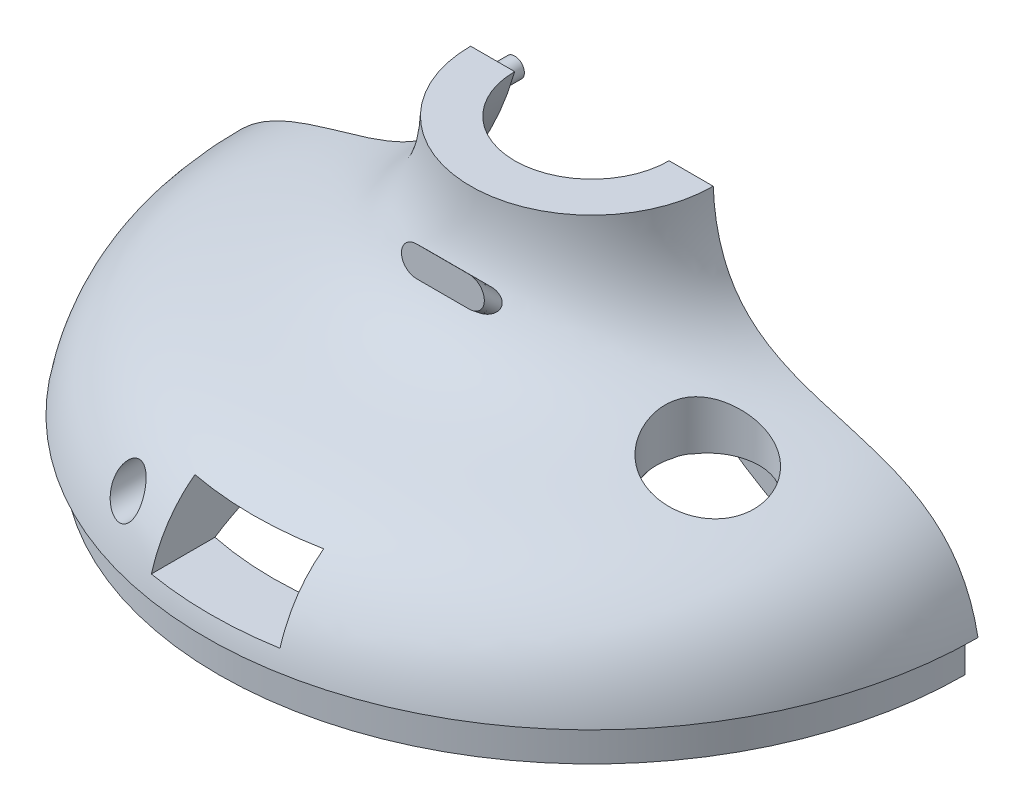
from build123d import *

# Parameters (mm, degrees)
R_VOLUTION1_ANGLE            = 90
ESQUISSE6_R                  = 3.75
BOSS_EXTRU_1_DEPTH           = 10
R_P_TITION_CIRCULAIRE2_COUNT = 2
R_P_TITION_CIRCULAIRE2_ANGLE = 270
R_P_TITION_CIRCULAIRE3_COUNT = 2
R_P_TITION_CIRCULAIRE3_ANGLE = 90
ESQUISSE10_R                 = 20
ENL_V_MAT_EXTRU_2_DEPTH      = 242.513478169
ESQUISSE11_R                 = 7.5
ESQUISSE11_W                 = 50
ESQUISSE11_H                 = 25
ENL_V_MAT_EXTRU_3_DEPTH      = 248.848260247
ESQUISSE12_W                 = 42.5
ESQUISSE12_H                 = 42.5
ENL_V_MAT_EXTRU_4_DEPTH      = 25


with BuildPart() as part:
    # Esquisse2 → Révolution1 (revolve)
    with BuildSketch(Plane.XY):
        with BuildLine():
            Line((30, 0), (47.131260288, 0))
            add(Edge.make_bspline(
                [(47.131260288, 0), (50.337430192, -76.684539626), (136.959304806, -31.563871951), (150, -100.45024926)],
                knots=[0, 0, 0, 0, 1, 1, 1, 1], degree=3))
            Line((150, -100.45024926), (145, -100.45024926))
            Line((145, -100.45024926), (145, -115.45024926))
            Line((145, -115.45024926), (135, -115.45024926))
            Line((135, -115.45024926), (135, -100.45024926))
            Line((135, -100.45024926), (130, -100.45024926))
            add(Edge.make_bspline(
                [(30, 0), (52.696130576, -79.217712587), (124.807660959, -82.686229226), (130, -100.45024926)],
                knots=[0, 0, 0, 0, 1, 1, 1, 1], degree=3))
        make_face()
    revolve(axis=Axis((0, 55, 0), (0, -1, 0)), revolution_arc=R_VOLUTION1_ANGLE)

    # Esquisse6 → Boss.-Extru.1 (add)
    with BuildSketch(Plane.ZY):
        with Locations(Location((40, -8.5, 0), (0, 0, 180))):
            Circle(ESQUISSE6_R)
        with Locations(Location((71.95431642, -52.883306602, 0), (0, 0, 180))):
            Circle(ESQUISSE6_R)
        with Locations(Location((125, -80, 0), (0, 0, 180))):
            Circle(ESQUISSE6_R)
    extrude(amount=BOSS_EXTRU_1_DEPTH)


with BuildPart() as r_p_tition_circulaire2_1:
    # Répétition circulaire2: pattern copy
    add(part.part.rotate(Axis((0, 55, 0), (0, -1, 0)), 1 * R_P_TITION_CIRCULAIRE2_ANGLE / (R_P_TITION_CIRCULAIRE2_COUNT - 1)))


with BuildPart() as part_1:
    add(part.part)

    # Combiner3: cut Répétition circulaire2_1
    add(r_p_tition_circulaire2_1.part, mode=Mode.SUBTRACT)


with BuildPart() as r_p_tition_circulaire3_1:
    # Répétition circulaire3: pattern copy
    add(part_1.part.rotate(Axis((0, 55, 0), (0, -1, 0)), 1 * R_P_TITION_CIRCULAIRE3_ANGLE / (R_P_TITION_CIRCULAIRE3_COUNT - 1)))


with BuildPart() as part_2:
    add(part_1.part)

    # Combiner4: union Répétition circulaire3_1
    add(r_p_tition_circulaire3_1.part)

    # Lissage2: read off the stored shape, not the designer's step
    # Lissage2: loft between two sections, ruled curve by curve
    lissage2_from = [
        Edge.make_bspline([(-10.141415638, -19.056019087, 58), (-8.212976489, -19.056019087, 58), (-4.745525631, -19.056019087, 58), (0.097340365, -19.056019087, 58), (4.940206361, -19.056019087, 58), (8.407657219, -19.056019087, 58), (10.992070669, -19.056019087, 58), (12.368530298, -19.277794454, 58), (14.347229759, -20.43033769, 58), (15.825485799, -22.4031348, 58), (16.381152507, -24.915194071, 58), (15.825485799, -27.427253342, 58), (14.347229759, -29.400050453, 58), (12.368530298, -30.552593688, 58), (10.992070669, -30.774369055, 58), (8.407657219, -30.774369055, 58), (4.940206361, -30.774369055, 58), (0.097340365, -30.774369055, 58), (-4.745525631, -30.774369055, 58), (-8.212976489, -30.774369055, 58), (-10.797389939, -30.774369055, 58), (-12.173849568, -30.552593688, 58), (-14.152549029, -29.400050453, 58), (-15.630805069, -27.427253342, 58), (-16.186471777, -24.915194071, 58), (-15.630805069, -22.4031348, 58), (-14.152549029, -20.43033769, 58), (-12.173849568, -19.277794454, 58), (-10.797389939, -19.056019087, 58), (-10.141415638, -19.056019087, 58)], [0, 0, 0, 0, 0.074390756, 0.148781511, 0.223172267, 0.297563023, 0.297563023, 0.322867645, 0.348172267, 0.373476889, 0.398781511, 0.424086134, 0.449390756, 0.474695378, 0.5, 0.5, 0.574390756, 0.648781511, 0.723172267, 0.797563023, 0.797563023, 0.822867645, 0.848172267, 0.873476889, 0.898781511, 0.924086134, 0.949390756, 0.974695378, 1, 1, 1, 1], 3),
    ]
    lissage2_to = [
        Edge.make_bspline([(-13.646593818, -29.959479994, 47), (-11.606942776, -29.959479994, 47), (-7.235758652, -29.959479994, 47), (0, -29.959479994, 47), (7.235758652, -29.959479994, 47), (11.606942776, -29.959479994, 47), (14.340397752, -29.959479994, 47), (15.598489603, -30.279278409, 47), (16.997996562, -31.3442136, 47), (17.857241012, -32.768726587, 47), (18.146490081, -34.362953291, 47), (17.857241012, -35.957179995, 47), (16.997996562, -37.381692982, 47), (15.598489603, -38.446628173, 47), (14.340397752, -38.766426588, 47), (11.606942776, -38.766426588, 47), (7.235758652, -38.766426588, 47), (0, -38.766426588, 47), (-7.235758652, -38.766426588, 47), (-11.606942776, -38.766426588, 47), (-14.340397752, -38.766426588, 47), (-15.598489603, -38.446628173, 47), (-16.997996562, -37.381692982, 47), (-17.857241012, -35.957179995, 47), (-18.146490081, -34.362953291, 47), (-17.857241012, -32.768726587, 47), (-16.997996562, -31.3442136, 47), (-15.598489603, -30.279278409, 47), (-14.340397752, -29.959479994, 47), (-13.646593818, -29.959479994, 47)], [0, 0, 0, 0, 0.074390756, 0.148781511, 0.223172267, 0.297563023, 0.297563023, 0.322867645, 0.348172267, 0.373476889, 0.398781511, 0.424086134, 0.449390756, 0.474695378, 0.5, 0.5, 0.574390756, 0.648781511, 0.723172267, 0.797563023, 0.797563023, 0.822867645, 0.848172267, 0.873476889, 0.898781511, 0.924086134, 0.949390756, 0.974695378, 1, 1, 1, 1], 3),
    ]
    lissage2 = Solid(Shell([*[Face.make_surface_from_curves(lissage2_from[k], lissage2_to[k]) for k in range(1)], Face(Wire(lissage2_from)), Face(Wire(lissage2_to))]))
    add(lissage2)

    # Lissage2 2: loft between two sections, ruled curve by curve
    lissage2_2_from = [
        Edge.make_bspline([(-10.141415638, -19.056019087, 58), (-8.212976489, -19.056019087, 58), (-4.745525631, -19.056019087, 58), (0.097340365, -19.056019087, 58), (4.940206361, -19.056019087, 58), (8.407657219, -19.056019087, 58), (10.992070669, -19.056019087, 58), (12.368530298, -19.277794454, 58), (14.347229759, -20.43033769, 58), (15.825485799, -22.4031348, 58), (16.381152507, -24.915194071, 58), (15.825485799, -27.427253342, 58), (14.347229759, -29.400050453, 58), (12.368530298, -30.552593688, 58), (10.992070669, -30.774369055, 58), (8.407657219, -30.774369055, 58), (4.940206361, -30.774369055, 58), (0.097340365, -30.774369055, 58), (-4.745525631, -30.774369055, 58), (-8.212976489, -30.774369055, 58), (-10.797389939, -30.774369055, 58), (-12.173849568, -30.552593688, 58), (-14.152549029, -29.400050453, 58), (-15.630805069, -27.427253342, 58), (-16.186471777, -24.915194071, 58), (-15.630805069, -22.4031348, 58), (-14.152549029, -20.43033769, 58), (-12.173849568, -19.277794454, 58), (-10.797389939, -19.056019087, 58), (-10.141415638, -19.056019087, 58)], [0, 0, 0, 0, 0.074390756, 0.148781511, 0.223172267, 0.297563023, 0.297563023, 0.322867645, 0.348172267, 0.373476889, 0.398781511, 0.424086134, 0.449390756, 0.474695378, 0.5, 0.5, 0.574390756, 0.648781511, 0.723172267, 0.797563023, 0.797563023, 0.822867645, 0.848172267, 0.873476889, 0.898781511, 0.924086134, 0.949390756, 0.974695378, 1, 1, 1, 1], 3),
    ]
    lissage2_2_to = [
        Edge.make_bspline([(-13.646593818, -29.959479994, 47), (-11.606942776, -29.959479994, 47), (-7.235758652, -29.959479994, 47), (0, -29.959479994, 47), (7.235758652, -29.959479994, 47), (11.606942776, -29.959479994, 47), (14.340397752, -29.959479994, 47), (15.598489603, -30.279278409, 47), (16.997996562, -31.3442136, 47), (17.857241012, -32.768726587, 47), (18.146490081, -34.362953291, 47), (17.857241012, -35.957179995, 47), (16.997996562, -37.381692982, 47), (15.598489603, -38.446628173, 47), (14.340397752, -38.766426588, 47), (11.606942776, -38.766426588, 47), (7.235758652, -38.766426588, 47), (0, -38.766426588, 47), (-7.235758652, -38.766426588, 47), (-11.606942776, -38.766426588, 47), (-14.340397752, -38.766426588, 47), (-15.598489603, -38.446628173, 47), (-16.997996562, -37.381692982, 47), (-17.857241012, -35.957179995, 47), (-18.146490081, -34.362953291, 47), (-17.857241012, -32.768726587, 47), (-16.997996562, -31.3442136, 47), (-15.598489603, -30.279278409, 47), (-14.340397752, -29.959479994, 47), (-13.646593818, -29.959479994, 47)], [0, 0, 0, 0, 0.074390756, 0.148781511, 0.223172267, 0.297563023, 0.297563023, 0.322867645, 0.348172267, 0.373476889, 0.398781511, 0.424086134, 0.449390756, 0.474695378, 0.5, 0.5, 0.574390756, 0.648781511, 0.723172267, 0.797563023, 0.797563023, 0.822867645, 0.848172267, 0.873476889, 0.898781511, 0.924086134, 0.949390756, 0.974695378, 1, 1, 1, 1], 3),
    ]
    lissage2_2 = Solid(Shell([*[Face.make_surface_from_curves(lissage2_2_from[k], lissage2_2_to[k]) for k in range(1)], Face(Wire(lissage2_2_from)), Face(Wire(lissage2_2_to))]))
    add(lissage2_2)

    # Esquisse10 → Enlèv. mat.-Extru.2 (cut, through all)
    with BuildSketch(Plane(origin=(0, 0, 0), x_dir=(1, 0, 0), z_dir=(0, 1, 0))):
        with Locations(Location((85, -40, 0), (0, 0, 270))):
            Circle(ESQUISSE10_R)
    extrude(amount=-ENL_V_MAT_EXTRU_2_DEPTH, mode=Mode.SUBTRACT)

    # Esquisse11 → Enlèv. mat.-Extru.3 (cut, through all)
    with BuildSketch(Plane.XY.offset(150)):
        with Locations((-45, -81.196994927)):
            Circle(ESQUISSE11_R)
        with Locations((0, -80.95024926)):
            Rectangle(ESQUISSE11_W, ESQUISSE11_H)
    extrude(amount=-ENL_V_MAT_EXTRU_3_DEPTH, mode=Mode.SUBTRACT)

    # Esquisse12 → Enlèv. mat.-Extru.4 (cut, symmetric)
    with BuildSketch(Plane(origin=(0, -90, 0), x_dir=(1, 0, 0), z_dir=(0, 1, 0))):
        with Locations((85, -40)):
            Rectangle(ESQUISSE12_W, ESQUISSE12_H)
    extrude(amount=ENL_V_MAT_EXTRU_4_DEPTH, both=True, mode=Mode.SUBTRACT)


solid = part_2.part
